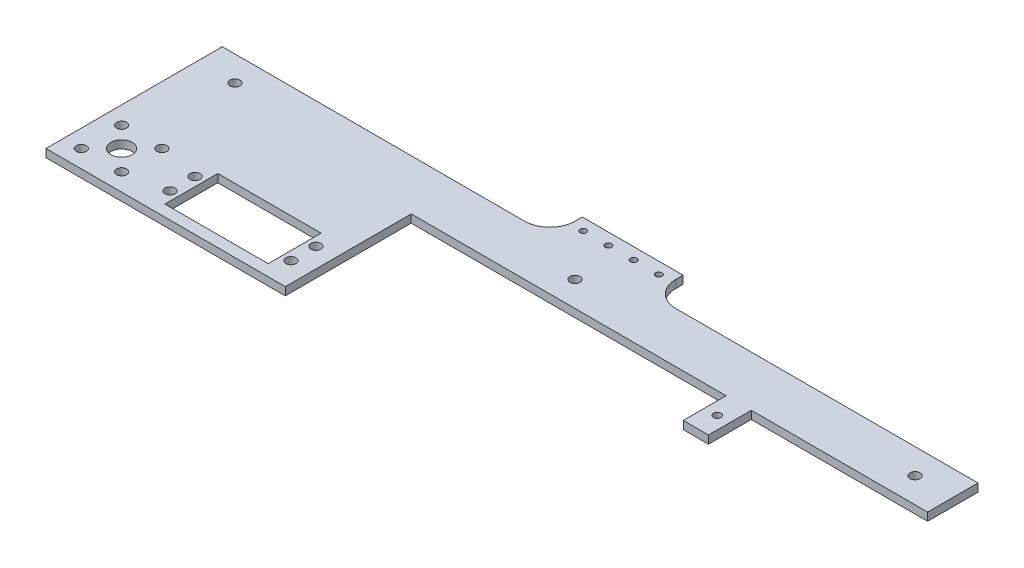
from build123d import *

# Parameters (mm, degrees)
SKETCH1_R           = 1.5
SKETCH1_R_2         = 2
SKETCH1_W           = 41
SKETCH1_H           = 21
SKETCH1_R_3         = 4.25
SKETCH1_R_4         = 1.25
BOSS_EXTRUDE1_DEPTH = 3.175
FILLET3_R           = 10
BOSS_EXTRUDE2_DEPTH = 3.175
SKETCH3_W           = 40
SKETCH3_H           = 3.7
CUT_EXTRUDE1_DEPTH  = 10


with BuildPart() as part:
    # Sketch1 → Boss-Extrude1 (new body)
    with BuildSketch(Plane(origin=(0, 0, 0), x_dir=(1, 0, 0), z_dir=(0, 1, 0))):
        Polygon((220, -17), (225, -17), (230, -17), (230, 10), (230, 20), (170, 20), (170, 36.6), (165, 36.6), (130, 36.6), (130, 20), (0, 20), (0, -50), (95, -50), (95, 0), (220, 0), align=None)
        with Locations((225, -8.5)):
            Circle(SKETCH1_R, mode=Mode.SUBTRACT)
        with Locations((15, 10)):
            Circle(SKETCH1_R_2, mode=Mode.SUBTRACT)
        with BuildLine():
            ThreePointArc((148, 10), (150, 12), (152, 10))
            ThreePointArc((152, 10), (150, 8), (148, 10))
        make_face(mode=Mode.SUBTRACT)
        with Locations((39.2, -30.05)):
            Circle(SKETCH1_R_2, mode=Mode.SUBTRACT)
        with Locations((39.2, -39.95)):
            Circle(SKETCH1_R_2, mode=Mode.SUBTRACT)
        with Locations((63.2, -35)):
            Rectangle(SKETCH1_W, SKETCH1_H, mode=Mode.SUBTRACT)
        with Locations((87.2, -39.95)):
            Circle(SKETCH1_R_2, mode=Mode.SUBTRACT)
        with Locations((87.2, -30.05)):
            Circle(SKETCH1_R_2, mode=Mode.SUBTRACT)
        with Locations((23, -27)):
            Circle(SKETCH1_R_2, mode=Mode.SUBTRACT)
        with Locations((15, -35)):
            Circle(SKETCH1_R_3, mode=Mode.SUBTRACT)
        with Locations((7, -43)):
            Circle(SKETCH1_R_2, mode=Mode.SUBTRACT)
        with Locations((7, -27)):
            Circle(SKETCH1_R_2, mode=Mode.SUBTRACT)
        with Locations((155, 28.3)):
            Circle(SKETCH1_R_4, mode=Mode.SUBTRACT)
        with Locations((135, 28.3)):
            Circle(SKETCH1_R_4, mode=Mode.SUBTRACT)
        with Locations((145, 28.3)):
            Circle(SKETCH1_R_4, mode=Mode.SUBTRACT)
        with Locations((165, 28.3)):
            Circle(SKETCH1_R_4, mode=Mode.SUBTRACT)
        with Locations((23, -43)):
            Circle(SKETCH1_R_2, mode=Mode.SUBTRACT)
    extrude(amount=BOSS_EXTRUDE1_DEPTH)

    # Fillet3
    fillet3_edges = [part.edges().sort_by_distance(p)[0] for p in [
        (170, 1.5875, -20),
        (130, 1.5875, -20),
    ]]
    fillet(fillet3_edges, radius=FILLET3_R)

    # Sketch2 → Boss-Extrude2 (add)
    with BuildSketch(Plane.XZ):
        Polygon((230, -10), (230, -20), (300, -20), (300, 0), (230, 0), align=None)
        with BuildLine():
            ThreePointArc((287, -10), (285, -12), (283, -10))
            ThreePointArc((283, -10), (285, -8), (287, -10))
        make_face(mode=Mode.SUBTRACT)
    extrude(amount=-BOSS_EXTRUDE2_DEPTH)

    # Sketch3 → Cut-Extrude1 (cut)
    with BuildSketch(Plane(origin=(0, 0, 0), x_dir=(-1, 0, 0), z_dir=(0, -1, 0))):
        with Locations((-150, 34.75)):
            Rectangle(SKETCH3_W, SKETCH3_H)
    extrude(amount=-CUT_EXTRUDE1_DEPTH, mode=Mode.SUBTRACT)


solid = part.part
